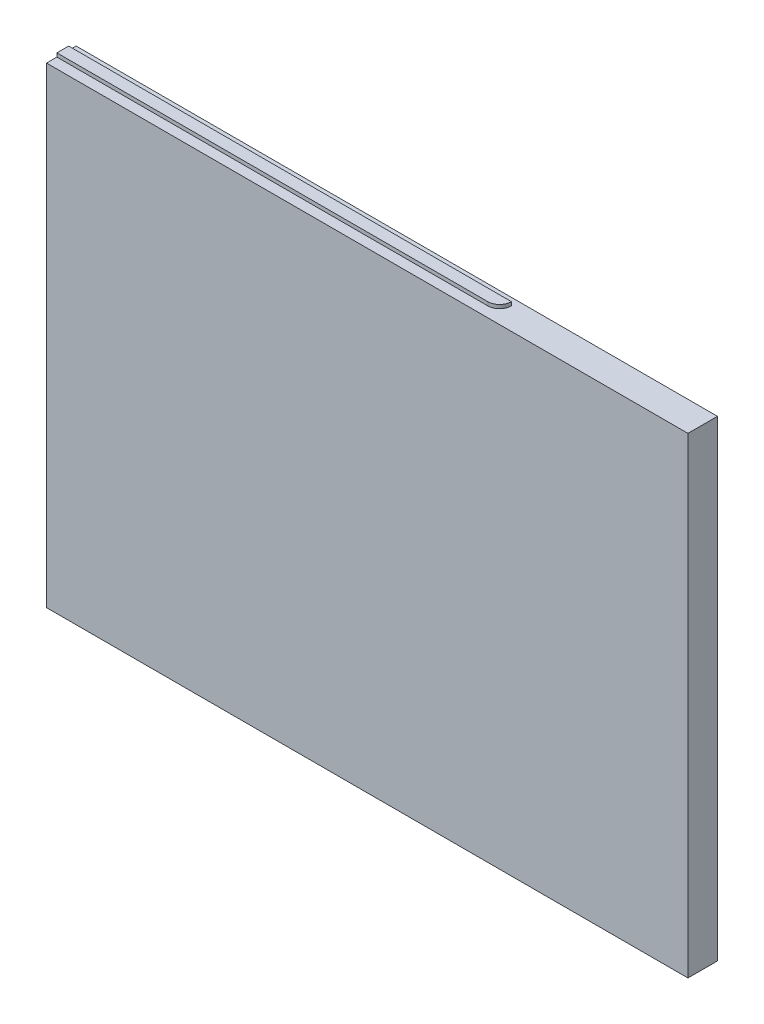
from build123d import *

# Parameters (mm, degrees)
ESBO_O1_W                     = 217.3
ESBO_O1_H                     = 159.8
RESSALTO_EXTRUS_O1_DEPTH      = 10
RESSALTO_EXTRUS_O2_DEPTH      = 1.24
RESSALTO_EXTRUS_O2_DEPTH_BACK = 161.04
ESBO_O2_W                     = 150
ESBO_O2_H                     = 4
FILETE1_R                     = 4
FILETE2_R                     = 4


with BuildPart() as part:
    # Esboço1 → Ressalto-extrusão1 (new body)
    with BuildSketch(Plane.XY):
        with Locations((41.520834075, -42.82072758)):
            Rectangle(ESBO_O1_W, ESBO_O1_H)
    extrude(amount=RESSALTO_EXTRUS_O1_DEPTH)

    # Esboço2 → Ressalto-extrusão2 (add, two sides: drawn at the far end of the back side and taken through both)
    with BuildSketch(Plane(origin=(0, 37.07927242, 0), x_dir=(1, 0, 0), z_dir=(0, 1, 0)).offset(-RESSALTO_EXTRUS_O2_DEPTH_BACK)):
        with Locations((7.870834075, -4.5)):
            Rectangle(ESBO_O2_W, ESBO_O2_H)
    extrude(amount=RESSALTO_EXTRUS_O2_DEPTH + RESSALTO_EXTRUS_O2_DEPTH_BACK)

    # Filete1
    filete1_edges = [part.edges().sort_by_distance(p)[0] for p in [
        (82.870834075, -123.34072758, 6.5),
    ]]
    fillet(filete1_edges, radius=FILETE1_R - 0.0001)  # a hair under: the kernel refuses the full size

    # Filete2
    filete2_edges = [part.edges().sort_by_distance(p)[0] for p in [
        (82.870834075, 37.69927242, 6.5),
    ]]
    fillet(filete2_edges, radius=FILETE2_R - 0.0001)  # a hair under: the kernel refuses the full size


solid = part.part
